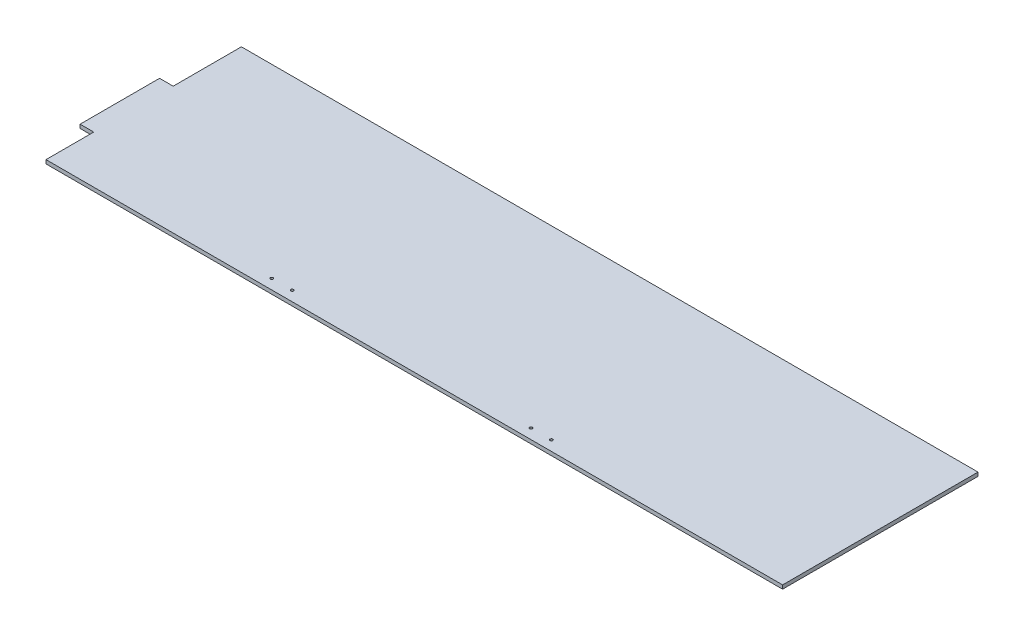
from build123d import *

# Parameters (mm, degrees)
BOSS_EXTRUDE1_START = 2
SKETCH1_R           = 1
BOSS_EXTRUDE1_DEPTH = 2.7432


with BuildPart() as part:
    # Sketch1 → Boss-Extrude1 (new body)
    with BuildSketch(Plane(origin=(0, 0, 0), x_dir=(1, 0, 0), z_dir=(0, 1, 0)).offset(BOSS_EXTRUDE1_START)):
        Polygon((-245.304365492, 24.17078832), (-255.304365492, 24.17078832), (-255.304365492, -34.080533091), (-245.304365492, -34.080533091), (-245.304365492, -69.080533091), (294.695634508, -69.080533091), (294.695634508, 74.17078832), (-245.304365492, 74.17078832), align=None)
        with Locations((-87.15619636, -61.754541309)):
            Circle(SKETCH1_R, mode=Mode.SUBTRACT)
        with Locations((-72.15619636, -61.754541309)):
            Circle(SKETCH1_R, mode=Mode.SUBTRACT)
        with Locations((102.84380364, -61.754541309)):
            Circle(SKETCH1_R, mode=Mode.SUBTRACT)
        with Locations((117.84380364, -61.754541309)):
            Circle(SKETCH1_R, mode=Mode.SUBTRACT)
    extrude(amount=BOSS_EXTRUDE1_DEPTH)


solid = part.part
